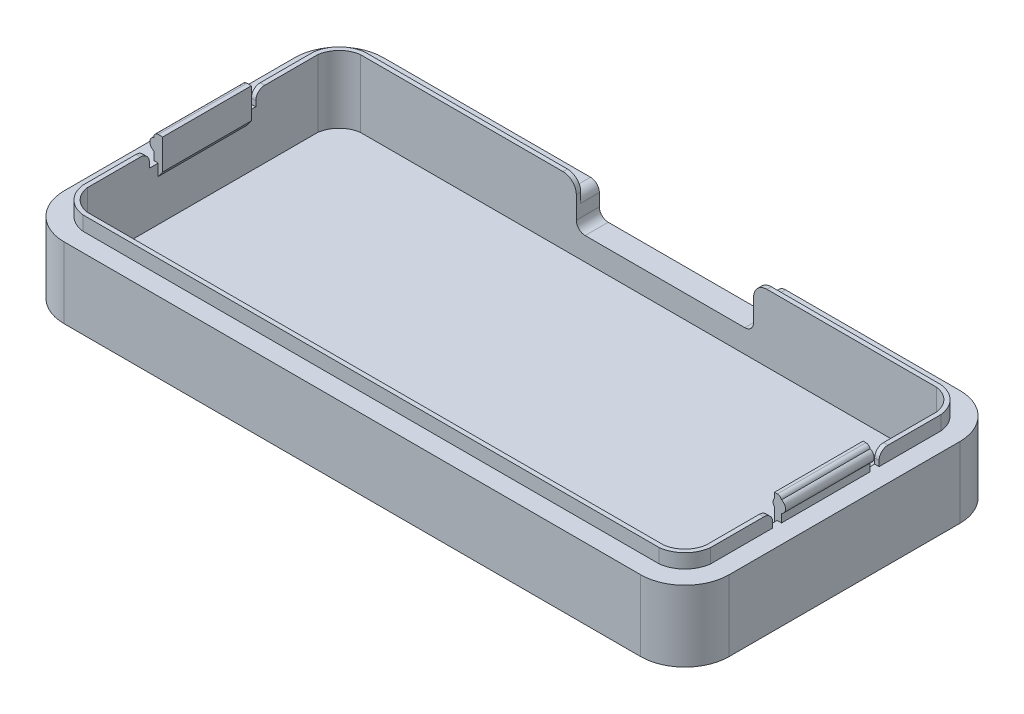
from build123d import *

# Parameters (mm, degrees)
EXTRUDE_2_DEPTH       = 8
EXTRUDE_4_DEPTH       = 1.6
SKETCH_7_W            = 0.5
SKETCH_7_H            = 10
EXTRUDE_8_DEPTH       = 2.8
SKETCH_8_R            = 0.7
EXTRUDE_9_DEPTH       = 10
FILLET_1_R            = 0.5
SKETCH_11_W           = 1
SKETCH_11_H           = 1.6
CUT_EXTRUDE_1_DEPTH   = 1.2
FILLET_2_R            = 1
SKETCH_13_W           = 0.5
SKETCH_13_H           = 10
EXTRUDE_10_DEPTH      = 2.8
CUT_EXTRUDE_START     = -6
CUT_EXTRUDE_2_DEPTH   = 6
SKETCH_13_2_W         = 0.5
SKETCH_13_2_H         = 10
EXTRUDE_11_DEPTH      = 2
EXTRUDE_12_DEPTH      = 1.6
EXTRUDE_12_DEPTH_BACK = 2
SKETCH_5_W            = 0.3
SKETCH_5_H            = 10
SKETCH_17_W           = 0.5
SKETCH_17_H           = 1
CUT_EXTRUDE_3_DEPTH   = 1.6
SKETCH_19_W           = 0.8
SKETCH_19_H           = 10
EXTRUDE_15_DEPTH      = 1
SKETCH_20_R           = 0.7
EXTRUDE_16_DEPTH      = 10
FILLET_4_R            = 0.5
CHAMFER_11_SIZE       = 1
CHAMFER_11_SIZE_2     = 1.37638192
FILLET_5_R            = 1
CHAMFER_12_SIZE       = 1
SKETCH_41_W           = 20
SKETCH_41_H           = 2.629178084
CUT_EXTRUDE_15_DEPTH  = 5
FILLET_6_R            = 1.5
FILLET_7_R            = 1
SKETCH_40_W           = 0.815007944
SKETCH_40_H           = 4.86663949
CUT_EXTRUDE_16_DEPTH  = 0.5


# Some blends are built 0.0001 mm under size
with BuildPart() as part:
    # case 2 → 凸台-拉伸2 (new body)
    with BuildSketch(Plane(origin=(0, 0, 0), x_dir=(1, 0, 0), z_dir=(0, 1, 0))):
        with BuildLine():
            Line((-34.042196447, 18), (30.957803553, 18))
            ThreePointArc((30.957803553, 18), (34.493337459, 16.535533906), (35.957803553, 13))
            Line((35.957803553, 13), (35.957803553, -13))
            ThreePointArc((35.957803553, -13), (34.493337459, -16.535533906), (30.957803553, -18))
            Line((30.957803553, -18), (-34.042196447, -18))
            ThreePointArc((-34.042196447, -18), (-37.577730353, -16.535533906), (-39.042196447, -13))
            Line((-39.042196447, -13), (-39.042196447, 13))
            ThreePointArc((-39.042196447, 13), (-37.577730353, 16.535533906), (-34.042196447, 18))
        make_face()
    extrude(amount=EXTRUDE_2_DEPTH)

    # 草图3 → 凸台-拉伸4 (add)
    with BuildSketch(Plane(origin=(0, 8, 0), x_dir=(1, 0, 0), z_dir=(0, 1, 0))):
        with BuildLine():
            Line((-36.942196447, 13), (-36.942196447, -13))
            ThreePointArc((-36.942196447, -13), (-35.997398295, -14.955201848), (-34.042196447, -15.9))
            Line((-34.042196447, -15.9), (30.957803553, -15.9))
            ThreePointArc((30.957803553, -15.9), (32.913005401, -14.955201848), (33.857803553, -13))
            Line((33.857803553, -13), (33.857803553, 13))
            ThreePointArc((33.857803553, 13), (32.913005401, 14.955201848), (30.957803553, 15.9))
            Line((30.957803553, 15.9), (-34.042196447, 15.9))
            ThreePointArc((-34.042196447, 15.9), (-35.997398295, 14.955201848), (-36.942196447, 13))
        make_face()
        with BuildLine():
            Line((-34.042196447, -15.4), (30.957803553, -15.4))
            ThreePointArc((30.957803553, -15.4), (32.562900965, -14.605097413), (33.357803553, -13))
            Line((33.357803553, -13), (33.357803553, 13))
            ThreePointArc((33.357803553, 13), (32.562900965, 14.605097413), (30.957803553, 15.4))
            Line((30.957803553, 15.4), (-34.042196447, 15.4))
            ThreePointArc((-34.042196447, 15.4), (-35.64729386, 14.605097413), (-36.442196447, 13))
            Line((-36.442196447, 13), (-36.442196447, -13))
            ThreePointArc((-36.442196447, -13), (-35.64729386, -14.605097413), (-34.042196447, -15.4))
        make_face(mode=Mode.SUBTRACT)
    extrude(amount=EXTRUDE_4_DEPTH)

    # 草图7 → 凸台-拉伸8 (add)
    with BuildSketch(Plane(origin=(0, 8, 0), x_dir=(1, 0, 0), z_dir=(0, 1, 0))):
        with Locations((-36.692196447, 0)):
            Rectangle(SKETCH_7_W, SKETCH_7_H)
    extrude(amount=EXTRUDE_8_DEPTH)

    # 草图8 → 凸台-拉伸9 (add)
    with BuildSketch(Plane.XY.offset(5)):
        with Locations((-36.692196447, 9.6)):
            Circle(SKETCH_8_R)
    extrude(amount=-EXTRUDE_9_DEPTH)

    # 圆角1
    fillet_1_edges = [part.edges().sort_by_distance(p)[0] for p in [
        (-36.942196447, 10.8, 0),
    ]]
    fillet(fillet_1_edges, radius=FILLET_1_R - 0.0001)  # a hair under: the kernel refuses the full size

    # 草图11 → 切除-拉伸1 (cut)
    with BuildSketch(Plane.ZY.offset(36.942196447)):
        with Locations((5.5, 8.8)):
            Rectangle(SKETCH_11_W, SKETCH_11_H)
        with Locations((-5.5, 8.8)):
            Rectangle(SKETCH_11_W, SKETCH_11_H)
    extrude(amount=-CUT_EXTRUDE_1_DEPTH, mode=Mode.SUBTRACT)

    # 圆角2
    fillet_2_edges = [part.edges().sort_by_distance(p)[0] for p in [
        (-36.692196447, 9.6, 6),
        (-36.692196447, 9.6, -6),
    ]]
    fillet(fillet_2_edges, radius=FILLET_2_R)

    # 草图13 → 凸台-拉伸10 (add)
    with BuildSketch(Plane(origin=(0, 8, 0), x_dir=(1, 0, 0), z_dir=(0, 1, 0))):
        with Locations((-36.192196447, 0)):
            Rectangle(SKETCH_13_W, SKETCH_13_H)
    extrude(amount=EXTRUDE_10_DEPTH)

    # 草图14 → 切除-拉伸2 (cut)
    with BuildSketch(Plane(origin=(0, 8, 0), x_dir=(1, 0, 0), z_dir=(0, 1, 0)).offset(CUT_EXTRUDE_START)):
        with BuildLine():
            Line((-34.042196447, -15.4), (30.957803553, -15.4))
            ThreePointArc((30.957803553, -15.4), (32.562900965, -14.605097413), (33.357803553, -13))
            Line((33.357803553, -13), (33.357803553, 13))
            ThreePointArc((33.357803553, 13), (32.562900965, 14.605097413), (30.957803553, 15.4))
            Line((30.957803553, 15.4), (-34.042196447, 15.4))
            ThreePointArc((-34.042196447, 15.4), (-35.64729386, 14.605097413), (-36.442196447, 13))
            Line((-36.442196447, 13), (-36.442196447, -13))
            ThreePointArc((-36.442196447, -13), (-35.64729386, -14.605097413), (-34.042196447, -15.4))
        make_face()
    extrude(amount=CUT_EXTRUDE_2_DEPTH, mode=Mode.SUBTRACT)

    # 草图13<2> → 凸台-拉伸11 (add)
    with BuildSketch(Plane(origin=(0, 8, 0), x_dir=(1, 0, 0), z_dir=(0, 1, 0))):
        with Locations((-36.192196447, 0)):
            Rectangle(SKETCH_13_2_W, SKETCH_13_2_H)
    extrude(amount=-EXTRUDE_11_DEPTH)

    # 草图5 → 凸台-拉伸12 (add, two sides: drawn at the far end of the back side and taken through both)
    with BuildSketch(Plane(origin=(0, 8, 0), x_dir=(1, 0, 0), z_dir=(0, 1, 0)).offset(-EXTRUDE_12_DEPTH_BACK)):
        with Locations((33.207803553, 0)):
            Rectangle(SKETCH_5_W, SKETCH_5_H)
    extrude(amount=EXTRUDE_12_DEPTH + EXTRUDE_12_DEPTH_BACK)

    # 草图17 → 切除-拉伸3 (cut)
    with BuildSketch(Plane(origin=(0, 9.6, 0), x_dir=(1, 0, 0), z_dir=(0, 1, 0))):
        with Locations((33.607803553, -5.5)):
            Rectangle(SKETCH_17_W, SKETCH_17_H)
        with Locations((33.607803553, 5.5)):
            Rectangle(SKETCH_17_W, SKETCH_17_H)
    extrude(amount=-CUT_EXTRUDE_3_DEPTH, mode=Mode.SUBTRACT)

    # 草图19 → 凸台-拉伸15 (add)
    with BuildSketch(Plane(origin=(0, 9.6, 0), x_dir=(1, 0, 0), z_dir=(0, 1, 0))):
        with Locations((33.457803553, 0)):
            Rectangle(SKETCH_19_W, SKETCH_19_H)
    extrude(amount=EXTRUDE_15_DEPTH)

    # 草图20 → 凸台-拉伸16 (add)
    with BuildSketch(Plane(origin=(0, 0, -5), x_dir=(-1, 0, 0), z_dir=(0, 0, -1))):
        with Locations((-33.607803553, 9.6)):
            Circle(SKETCH_20_R)
    extrude(amount=-EXTRUDE_16_DEPTH)

    # 圆角4
    # the kernel refuses this fillet: 0.5 mm, written as the material it takes off along each edge
    with BuildSketch(Plane(origin=(33.857803553, 10.6, -6.189366537), x_dir=(-1, 0, 0), z_dir=(0, 0, 1))) as fillet_4_piece_1:
        with BuildLine():
            CenterArc((0.475746615, 0.5), FILLET_4_R, 197.918850754, 72.081149246)
            Line((0, 0.346165158), (-0.009514932, 0.343088462))
            ThreePointArc((-0.009514932, 0.343088462), (-0.01, 0.173082579), (-0.01, 0))
            Line((-0.01, 0), (0, -0.01))
            Line((0, -0.01), (0.475746615, -0.01))
            Line((0.475746615, -0.01), (0.475746615, 0))
        make_face()
    extrude(amount=12.378733074, mode=Mode.SUBTRACT)

    # 倒角11
    # the kernel refuses this chamfer: 1.37638192, 1 mm, written as the material it takes off along each edge
    with BuildSketch(Plane(origin=(-35.942196447, 6, 8.553227563), x_dir=(-0.9990705747005859, -0.04310437063037643, 0), z_dir=(0, 0, -1))) as chamfer_11_piece_1_section:
        Polygon((CHAMFER_11_SIZE * 0.999070574701, CHAMFER_11_SIZE * 0.0431043706304), (-CHAMFER_11_SIZE_2 * 0.0431043706451, CHAMFER_11_SIZE_2 * 0.999070575043), (0, 0), align=None)
    chamfer_11_piece_1 = extrude(amount=17.106455125, mode=Mode.PRIVATE)
    chamfer_11_piece_1 = split(chamfer_11_piece_1, bisect_by=Plane(origin=(-36.442196447, 6.546250957, 0), z_dir=(1, 0, 0)), keep=Keep.TOP, mode=Mode.PRIVATE)
    add(chamfer_11_piece_1, mode=Mode.SUBTRACT)

    # 圆角5
    fillet_5_edges = [part.edges().sort_by_distance(p)[0] for p in [
        (33.607803553, 9.6, 6),
        (33.607803553, 9.6, -6),
    ]]
    fillet(fillet_5_edges, radius=FILLET_5_R)

    # 倒角12
    # the kernel refuses this chamfer: 1 mm, written as the material it takes off along each edge
    with BuildSketch(Plane(origin=(33.057803553, 6, 7.571682988), x_dir=(0.9996219169112968, -0.027495876610586414, 0), z_dir=(0, 0, -1))) as chamfer_12_piece_1_section:
        Polygon((CHAMFER_12_SIZE * 0.999621916911, -CHAMFER_12_SIZE * 0.0274958766106), (-CHAMFER_12_SIZE * 0.0274958766106, -CHAMFER_12_SIZE * 0.999621916911), (0, 0), align=None)
    chamfer_12_piece_1 = extrude(amount=15.143365976, mode=Mode.PRIVATE)
    chamfer_12_piece_1 = split(chamfer_12_piece_1, bisect_by=Plane(origin=(33.357803553, 6.436497273, 0), z_dir=(-1, 0, 0)), keep=Keep.TOP, mode=Mode.PRIVATE)
    add(chamfer_12_piece_1, mode=Mode.SUBTRACT)

    # 草图41 → 切除-拉伸15 (cut)
    with BuildSketch(Plane(origin=(0, 9.6, 0), x_dir=(1, 0, 0), z_dir=(0, 1, 0))):
        with Locations((0.309679061, 16.685410958)):
            Rectangle(SKETCH_41_W, SKETCH_41_H)
    extrude(amount=-CUT_EXTRUDE_15_DEPTH, mode=Mode.SUBTRACT)

    # 圆角6
    fillet_6_edges = [part.edges().sort_by_distance(p)[0] for p in [
        (10.309679061, 9.6, -15.65),
        (-9.690320939, 9.6, -15.65),
    ]]
    fillet(fillet_6_edges, radius=FILLET_6_R)

    # 圆角7
    fillet_7_edges = [part.edges().sort_by_distance(p)[0] for p in [
        (10.309679061, 8, -16.95),
        (-9.690320939, 8, -16.95),
        (10.309679061, 4.6, -16.7),
        (-9.690320939, 4.6, -16.7),
    ]]
    fillet(fillet_7_edges, radius=FILLET_7_R)

    # 草图40 → 切除-拉伸16 (cut)
    # profile 1 of 9: a face of its own
    with BuildSketch(Plane.XZ):
        with BuildLine():
            Line((-26.796380023, 4.263919287), (-26.796380023, -2.551685513))
            add(Edge.make_bspline(
                [(-26.796380023, -2.551685513), (-26.796380023, -3.167115292), (-26.465813469, -3.731311428), (-25.935877439, -4.039026317)],
                knots=[10, 10, 10, 10, 11, 11, 11, 11], degree=3))
            Line((-25.935877439, -4.039026317), (-25.115234838, -4.512024483))
            Line((-25.115234838, -4.512024483), (-20.858355687, -6.968143721))
            Line((-20.858355687, -6.968143721), (-20.037713086, -7.446811326))
            add(Edge.make_bspline(
                [(-20.037713086, -7.446811326), (-19.769892961, -7.600686162), (-19.473551731, -7.674771469), (-19.177210502, -7.674771469)],
                knots=[14, 14, 14, 14, 15, 15, 15, 15], degree=3))
            add(Edge.make_bspline(
                [(-19.177210502, -7.674771469), (-18.880869273, -7.674771469), (-18.584597607, -7.600686162), (-18.316707918, -7.446811326)],
                knots=[15, 15, 15, 15, 16, 16, 16, 16], degree=3))
            Line((-18.316707918, -7.446811326), (-17.496134881, -6.968143721))
            Line((-17.496134881, -6.968143721), (-13.239255729, -4.512024483))
            Line((-13.239255729, -4.512024483), (-12.418682692, -4.039026317))
            add(Edge.make_bspline(
                [(-12.418682692, -4.039026317), (-11.882972878, -3.731311428), (-11.558180108, -3.167115292), (-11.558180108, -2.551685513)],
                knots=[19, 19, 19, 19, 20, 20, 20, 20], degree=3))
            Line((-11.558180108, -2.551685513), (-11.558180108, 4.263919287))
            add(Edge.make_bspline(
                [(-11.558180108, 4.263919287), (-11.558180108, 4.873679626), (-11.882972878, 5.443545202), (-12.418682692, 5.751260091)],
                knots=[21, 21, 21, 21, 22, 22, 22, 22], degree=3))
            Line((-12.418682692, 5.751260091), (-13.239255729, 6.224258257))
            Line((-13.239255729, 6.224258257), (-17.496134881, 8.680377495))
            Line((-17.496134881, 8.680377495), (-18.316707918, 9.159079882))
            add(Edge.make_bspline(
                [(-18.316707918, 9.159079882), (-18.584597607, 9.307215715), (-18.880869273, 9.387005243), (-19.177210502, 9.387005243)],
                knots=[3, 3, 3, 3, 4, 4, 4, 4], degree=3))
            add(Edge.make_bspline(
                [(-19.177210502, 9.387005243), (-19.473551731, 9.387005243), (-19.769892961, 9.307215715), (-20.037713086, 9.159079882)],
                knots=[4, 4, 4, 4, 5, 5, 5, 5], degree=3))
            Line((-20.037713086, 9.159079882), (-20.858355687, 8.680377495))
            Line((-20.858355687, 8.680377495), (-25.115234838, 6.224258257))
            Line((-25.115234838, 6.224258257), (-25.935877439, 5.751260091))
            add(Edge.make_bspline(
                [(-25.935877439, 5.751260091), (-26.465813469, 5.443545202), (-26.796380023, 4.873679626), (-26.796380023, 4.263919287)],
                knots=[8, 8, 8, 8, 9, 9, 9, 9], degree=3))
        make_face()
        with BuildLine():
            Line((-24.841710492, 5.073118665), (-19.576158143, 8.11621614))
            add(Edge.make_bspline(
                [(-19.576158143, 8.11621614), (-19.331085337, 8.258682534), (-19.023335666, 8.258682534), (-18.772628204, 8.11621614)],
                knots=[3, 3, 3, 3, 4, 4, 4, 4], degree=3))
            Line((-18.772628204, 8.11621614), (-13.535596959, 5.067414444))
            add(Edge.make_bspline(
                [(-13.535596959, 5.067414444), (-13.267776834, 4.913574391), (-13.262072613, 4.526069973), (-13.529892738, 4.366490917)],
                knots=[5, 5, 5, 5, 6, 6, 6, 6], degree=3))
            Line((-13.529892738, 4.366490917), (-18.618753368, 1.323428223))
            add(Edge.make_bspline(
                [(-18.618753368, 1.323428223), (-18.960728365, 1.123954403), (-19.388127546, 1.123954403), (-19.730032978, 1.323428223)],
                knots=[7, 7, 7, 7, 8, 8, 8, 8], degree=3))
            add(Edge.make_bspline(
                [(-19.730032978, 1.323428223), (-24.881570474, 4.29810983), (-24.892978916, 4.303814051)],
                knots=[0, 0, 0, 1, 1, 1], degree=2))
            add(Edge.make_bspline(
                [(-24.892978916, 4.303814051), (-25.160799041, 4.497548869), (-25.132347501, 4.90787017), (-24.841710492, 5.073118665)],
                knots=[1, 1, 1, 1, 2, 2, 2, 2], degree=3))
        make_face(mode=Mode.SUBTRACT)
        with BuildLine():
            Line((-17.040214595, -3.833883057), (-17.632897054, -4.164380048))
            Line((-17.632897054, -4.164380048), (-17.632897054, -3.081656324))
            Line((-17.632897054, -3.081656324), (-17.108665245, -2.819505638))
            add(Edge.make_bspline(
                [(-16.151260471, -1.434736464), (-16.151260471, -1.976115717), (-16.458940578, -2.454783323), (-17.108665245, -2.819505638)],
                knots=[0, 0, 0, 0, 1, 1, 1, 1], degree=3))
            add(Edge.make_bspline(
                [(-17.142821007, -1.246671086), (-16.504574345, -0.881983552), (-16.151260471, -0.876279331), (-16.151260471, -1.434736464)],
                knots=[6, 6, 6, 6, 7, 7, 7, 7], degree=3))
            Line((-17.142821007, -1.246671086), (-17.632897054, -1.520230213))
            add(Edge.make_bspline(
                [(-17.689939262, -1.617097622), (-17.689939262, -1.577202858), (-17.667122379, -1.537308094), (-17.632897054, -1.520230213)],
                knots=[4, 4, 4, 4, 5, 5, 5, 5], degree=3))
            Line((-17.689939262, -1.617097622), (-17.689939262, -2.961972032))
            Line((-17.689939262, -2.961972032), (-17.689939262, -4.261282239))
            Line((-17.689939262, -4.261282239), (-17.689939262, -5.970878964))
            add(Edge.make_bspline(
                [(-17.689939262, -5.970878964), (-17.689939262, -6.010773728), (-17.706982361, -6.044964272), (-17.746842343, -6.067746373)],
                knots=[3, 3, 3, 3, 4, 4, 4, 4], degree=3))
            Line((-17.746842343, -6.067746373), (-18.852417732, -6.694584593))
            add(Edge.make_bspline(
                [(-18.852417732, -6.694584593), (-18.926503039, -6.734479357), (-19.017701009, -6.683210933), (-19.017701009, -6.597717184)],
                knots=[5, 5, 5, 5, 6, 6, 6, 6], degree=3))
            Line((-19.017701009, -6.597717184), (-19.017701009, -1.320756393))
            add(Edge.make_bspline(
                [(-19.017701009, -1.320756393), (-19.017701009, -1.280861629), (-19.000588347, -1.240966865), (-18.960728365, -1.223888984)],
                knots=[7, 7, 7, 7, 8, 8, 8, 8], degree=3))
            Line((-18.960728365, -1.223888984), (-17.080144141, -0.158243141))
            add(Edge.make_bspline(
                [(-17.080144141, -0.158243141), (-15.860623463, 0.531306726), (-14.852019828, 0.668068899), (-14.852019828, -0.699622394)],
                knots=[9, 9, 9, 9, 10, 10, 10, 10], degree=3))
            add(Edge.make_bspline(
                [(-14.852019828, -0.699622394), (-14.852019828, -2.016010481), (-15.872031904, -3.172819512), (-17.040214595, -3.833883057)],
                knots=[10, 10, 10, 10, 11, 11, 11, 11], degree=3))
        make_face(mode=Mode.SUBTRACT)
        with BuildLine():
            Line((-13.136718882, -3.480569183), (-14.230816265, -4.101703182))
            add(Edge.make_bspline(
                [(-14.230816265, -4.101703182), (-14.304901573, -4.141597947), (-14.396099542, -4.090294741), (-14.396099542, -4.004835774)],
                knots=[2, 2, 2, 2, 3, 3, 3, 3], degree=3))
            Line((-14.396099542, -4.004835774), (-14.396099542, -1.491709109))
            add(Edge.make_bspline(
                [(-14.396099542, -1.491709109), (-14.396099542, -1.451849127), (-14.373282659, -1.417623802), (-14.339057334, -1.3948417)],
                knots=[4, 4, 4, 4, 5, 5, 5, 5], degree=3))
            Line((-14.339057334, -1.3948417), (-13.24495995, -0.77937714))
            add(Edge.make_bspline(
                [(-13.24495995, -0.77937714), (-13.170874643, -0.739517158), (-13.079676673, -0.790785582), (-13.079676673, -0.876279331)],
                knots=[6, 6, 6, 6, 7, 7, 7, 7], degree=3))
            Line((-13.079676673, -0.876279331), (-13.079676673, -3.383666993))
            add(Edge.make_bspline(
                [(-13.079676673, -3.383666993), (-13.079676673, -3.423561757), (-13.102493557, -3.463456521), (-13.136718882, -3.480569183)],
                knots=[0, 0, 0, 0, 1, 1, 1, 1], degree=3))
        make_face(mode=Mode.SUBTRACT)
        with BuildLine():
            add(Edge.make_bspline(
                [(-13.735035997, 0.890324821), (-13.296228374, 1.141067065), (-12.982844046, 1.032791215), (-12.982844046, 0.633878356), (-12.982844046, 0.240669718), (-13.296228374, -0.220920007), (-13.735035997, -0.46595803)],
                knots=[2, 2, 2, 2, 3, 3, 3, 4, 4, 4, 4], degree=3))
            add(Edge.make_bspline(
                [(-13.735035997, -0.46595803), (-14.179478278, -0.722404496), (-14.492932169, -0.614128645), (-14.492932169, -0.220920007), (-14.492932169, 0.183697073), (-14.179478278, 0.639582577), (-13.735035997, 0.890324821)],
                knots=[0, 0, 0, 0, 1, 1, 1, 2, 2, 2, 2], degree=3))
        make_face(mode=Mode.SUBTRACT)
    # profile 2 of 9: a face of its own
    with BuildSketch(Plane.XZ):
        with BuildLine():
            Line((-7.563416861, 3.7852169), (-9.438296864, 3.7852169))
            Line((-9.438296864, 3.7852169), (-9.438296864, -2.779610874))
            Line((-9.438296864, -2.779610874), (-8.606245821, -2.779610874))
            Line((-8.606245821, -2.779610874), (-8.606245821, -0.175321022))
            Line((-8.606245821, -0.175321022), (-7.517783094, -0.175321022))
            add(Edge.make_bspline(
                [(-7.517783094, -0.175321022), (-6.087414936, -0.175321022), (-5.101558621, 0.4742993), (-5.101558621, 1.859103255)],
                knots=[5, 5, 5, 5, 6, 6, 6, 6], degree=3))
            add(Edge.make_bspline(
                [(-5.101558621, 1.859103255), (-5.101558621, 3.295140853), (-6.087414936, 3.7852169), (-7.563416861, 3.7852169)],
                knots=[6, 6, 6, 6, 7, 7, 7, 7], degree=3))
        make_face()
        with BuildLine():
            Line((-7.626024163, 0.497116183), (-8.606245821, 0.497116183))
            Line((-8.606245821, 0.497116183), (-8.606245821, 3.112779695))
            Line((-8.606245821, 3.112779695), (-7.660249488, 3.112779695))
            add(Edge.make_bspline(
                [(-7.660249488, 3.112779695), (-6.509109896, 3.112779695), (-5.927835879, 2.810769027), (-5.927835879, 1.859103255)],
                knots=[3, 3, 3, 3, 4, 4, 4, 4], degree=3))
            add(Edge.make_bspline(
                [(-5.927835879, 1.859103255), (-5.927835879, 0.918811144), (-6.469249914, 0.497116183), (-7.626024163, 0.497116183)],
                knots=[4, 4, 4, 4, 5, 5, 5, 5], degree=3))
        make_face(mode=Mode.SUBTRACT)
    # profile 3 of 9: a face of its own
    with BuildSketch(Plane.XZ):
        with Locations((-3.617069928, -0.346291129)):
            Rectangle(SKETCH_40_W, SKETCH_40_H)
    # profile 4 of 9: a face of its own
    with BuildSketch(Plane.XZ):
        with BuildLine():
            Line((1.497459697, 1.009974332), (0.665478217, 1.340506104))
            add(Edge.make_bspline(
                [(0.665478217, 1.340506104), (0.07849998, 1.574170468), (-0.343194981, 1.716636861), (-0.343194981, 2.087028616)],
                knots=[1, 1, 1, 1, 2, 2, 2, 2], degree=3))
            add(Edge.make_bspline(
                [(-0.343194981, 2.087028616), (-0.343194981, 2.44034249), (-0.041149531, 2.639816311), (0.454630737, 2.639816311)],
                knots=[2, 2, 2, 2, 3, 3, 3, 3], degree=3))
            add(Edge.make_bspline(
                [(0.454630737, 2.639816311), (0.973158325, 2.639816311), (1.383514407, 2.463159374), (1.822252467, 2.12692338)],
                knots=[3, 3, 3, 3, 4, 4, 4, 4], degree=3))
            Line((1.822252467, 2.12692338), (2.620147748, 3.129892358))
            add(Edge.make_bspline(
                [(2.620147748, 3.129892358), (2.038873731, 3.716835814), (1.223935351, 4.013177043), (0.454630737, 4.013177043)],
                knots=[5, 5, 5, 5, 6, 6, 6, 6], degree=3))
            add(Edge.make_bspline(
                [(0.454630737, 4.013177043), (-0.96432898, 4.013177043), (-1.967297957, 3.112779695), (-1.967297957, 1.995865428)],
                knots=[6, 6, 6, 6, 7, 7, 7, 7], degree=3))
            add(Edge.make_bspline(
                [(-1.967297957, 1.995865428), (-1.967297957, 1.027086994), (-1.312008197, 0.445812977), (-0.611015106, 0.16658441)],
                knots=[7, 7, 7, 7, 8, 8, 8, 8], degree=3))
            Line((-0.611015106, 0.16658441), (0.238079036, -0.192433684))
            add(Edge.make_bspline(
                [(0.238079036, -0.192433684), (0.807944611, -0.431767487), (1.178371148, -0.557156), (1.178371148, -0.944660417)],
                knots=[9, 9, 9, 9, 10, 10, 10, 10], degree=3))
            add(Edge.make_bspline(
                [(1.178371148, -0.944660417), (1.178371148, -1.303678512), (0.899142581, -1.525899652), (0.306460122, -1.525899652)],
                knots=[10, 10, 10, 10, 11, 11, 11, 11], degree=3))
            add(Edge.make_bspline(
                [(0.306460122, -1.525899652), (-0.217771686, -1.525899652), (-0.838975249, -1.246671086), (-1.312008197, -0.842088788)],
                knots=[11, 11, 11, 11, 12, 12, 12, 12], degree=3))
            Line((-1.312008197, -0.842088788), (-2.21800542, -1.947629395))
            add(Edge.make_bspline(
                [(-2.21800542, -1.947629395), (-1.528490334, -2.580171836), (-0.593972007, -2.904999387), (0.272234797, -2.904999387)],
                knots=[13, 13, 13, 13, 14, 14, 14, 14], degree=3))
            add(Edge.make_bspline(
                [(0.272234797, -2.904999387), (1.884998896, -2.904999387), (2.819517223, -1.930516732), (2.819517223, -0.819271904)],
                knots=[14, 14, 14, 14, 15, 15, 15, 15], degree=3))
            add(Edge.make_bspline(
                [(2.819517223, -0.819271904), (2.819517223, 0.120985426), (2.323806519, 0.679477341), (1.497459697, 1.009974332)],
                knots=[15, 15, 15, 15, 16, 16, 16, 16], degree=3))
        make_face()
    # profile 5 of 9: a face of its own
    with BuildSketch(Plane.XZ):
        with BuildLine():
            Line((6.603502553, 2.314988759), (6.603502553, -1.024449946))
            add(Edge.make_bspline(
                [(6.603502553, -1.024449946), (6.335682428, -1.400545921), (6.113356943, -1.543012315), (5.754408412, -1.543012315)],
                knots=[1, 1, 1, 1, 2, 2, 2, 2], degree=3))
            add(Edge.make_bspline(
                [(5.754408412, -1.543012315), (5.34975655, -1.543012315), (5.161725953, -1.343573276), (5.161725953, -0.636910746)],
                knots=[2, 2, 2, 2, 3, 3, 3, 3], degree=3))
            Line((5.161725953, -0.636910746), (5.161725953, 2.314988759))
            Line((5.161725953, 2.314988759), (3.571778738, 2.314988759))
            Line((3.571778738, 2.314988759), (3.571778738, -0.836384567))
            add(Edge.make_bspline(
                [(3.571778738, -0.836384567), (3.571778738, -2.107173669), (4.044811686, -2.904999387), (5.156021732, -2.904999387)],
                knots=[6, 6, 6, 6, 7, 7, 7, 7], degree=3))
            add(Edge.make_bspline(
                [(5.156021732, -2.904999387), (5.851241039, -2.904999387), (6.329978208, -2.580171836), (6.751673168, -2.078687347)],
                knots=[7, 7, 7, 7, 8, 8, 8, 8], degree=3))
            Line((6.751673168, -2.078687347), (6.785828929, -2.078687347))
            Line((6.785828929, -2.078687347), (6.899843783, -2.779610874))
            Line((6.899843783, -2.779610874), (8.199084426, -2.779610874))
            Line((8.199084426, -2.779610874), (8.199084426, 2.314988759))
            Line((8.199084426, 2.314988759), (6.603502553, 2.314988759))
        make_face()
    # profile 6 of 9: a face of its own
    with BuildSketch(Plane.XZ):
        with BuildLine():
            Line((12.051381279, -1.776641897), (11.24785134, -1.776641897))
            add(Edge.make_bspline(
                [(11.24785134, -1.776641897), (10.700802648, -1.776641897), (10.495659389, -1.668366046), (10.495659389, -1.434736464)],
                knots=[1, 1, 1, 1, 2, 2, 2, 2], degree=3))
            add(Edge.make_bspline(
                [(10.495659389, -1.434736464), (10.495659389, -1.263783748), (10.535519371, -1.18399422), (10.655168882, -1.07571837)],
                knots=[2, 2, 2, 2, 3, 3, 3, 3], degree=3))
            add(Edge.make_bspline(
                [(10.655168882, -1.07571837), (10.877494367, -1.138395235), (11.082568063, -1.166916339), (11.253555561, -1.166916339)],
                knots=[3, 3, 3, 3, 4, 4, 4, 4], degree=3))
            add(Edge.make_bspline(
                [(11.253555561, -1.166916339), (12.38187827, -1.166916339), (13.28801462, -0.648319188), (13.28801462, 0.542680386)],
                knots=[4, 4, 4, 4, 5, 5, 5, 5], degree=3))
            add(Edge.make_bspline(
                [(13.28801462, 0.542680386), (13.28801462, 0.787753191), (13.225268191, 1.021382773), (13.145548226, 1.163849167)],
                knots=[5, 5, 5, 5, 6, 6, 6, 6], degree=3))
            Line((13.145548226, 1.163849167), (13.931895939, 1.163849167))
            Line((13.931895939, 1.163849167), (13.931895939, 2.314988759))
            Line((13.931895939, 2.314988759), (12.062789721, 2.314988759))
            add(Edge.make_bspline(
                [(12.062789721, 2.314988759), (11.829125357, 2.400447726), (11.54989679, 2.44034249), (11.253555561, 2.44034249)],
                knots=[9, 9, 9, 9, 10, 10, 10, 10], degree=3))
            add(Edge.make_bspline(
                [(11.253555561, 2.44034249), (10.153753957, 2.44034249), (9.122263875, 1.836286372), (9.122263875, 0.588279371)],
                knots=[10, 10, 10, 10, 11, 11, 11, 11], degree=3))
            add(Edge.make_bspline(
                [(9.122263875, 0.588279371), (9.122263875, -0.004368306), (9.452830429, -0.477366472), (9.811778961, -0.728108716)],
                knots=[11, 11, 11, 11, 12, 12, 12, 12], degree=3))
            Line((9.811778961, -0.728108716), (9.811778961, -0.76229926))
            add(Edge.make_bspline(
                [(9.811778961, -0.76229926), (9.48128197, -0.995928841), (9.247617606, -1.354946936), (9.247617606, -1.713965031)],
                knots=[13, 13, 13, 13, 14, 14, 14, 14], degree=3))
            add(Edge.make_bspline(
                [(9.247617606, -1.713965031), (9.247617606, -2.141364213), (9.447126208, -2.409219119), (9.714946333, -2.591580277)],
                knots=[14, 14, 14, 14, 15, 15, 15, 15], degree=3))
            Line((9.714946333, -2.591580277), (9.714946333, -2.63714448))
            add(Edge.make_bspline(
                [(9.714946333, -2.63714448), (9.241913385, -2.876513065), (8.991205923, -3.218418497), (8.991205923, -3.640113458)],
                knots=[16, 16, 16, 16, 17, 17, 17, 17], degree=3))
            add(Edge.make_bspline(
                [(8.991205923, -3.640113458), (8.991205923, -4.551884465), (9.954245354, -4.922311002), (11.12820183, -4.922311002)],
                knots=[17, 17, 17, 17, 18, 18, 18, 18], degree=3))
            add(Edge.make_bspline(
                [(11.12820183, -4.922311002), (12.900475421, -4.922311002), (14.011755031, -4.158710609), (14.011755031, -3.081656324)],
                knots=[18, 18, 18, 18, 19, 19, 19, 19], degree=3))
            add(Edge.make_bspline(
                [(14.011755031, -3.081656324), (14.011755031, -2.158476875), (13.305127283, -1.776641897), (12.051381279, -1.776641897)],
                knots=[19, 19, 19, 19, 20, 20, 20, 20], degree=3))
        make_face()
        with BuildLine():
            Line((11.264964003, -2.996162575), (11.749405392, -2.996162575))
            add(Edge.make_bspline(
                [(11.749405392, -2.996162575), (12.222299213, -2.996162575), (12.490188902, -3.058839441), (12.490188902, -3.360884891)],
                knots=[4, 4, 4, 4, 5, 5, 5, 5], degree=3))
            add(Edge.make_bspline(
                [(12.490188902, -3.360884891), (12.490188902, -3.685712443), (12.03433818, -3.925046245), (11.378909292, -3.925046245)],
                knots=[5, 5, 5, 5, 6, 6, 6, 6], degree=3))
            add(Edge.make_bspline(
                [(11.378909292, -3.925046245), (10.723619532, -3.925046245), (10.29622035, -3.748389308), (10.29622035, -3.389371213)],
                knots=[0, 0, 0, 0, 1, 1, 1, 1], degree=3))
            add(Edge.make_bspline(
                [(10.29622035, -3.389371213), (10.29622035, -3.218418497), (10.375940315, -3.075952103), (10.535519371, -2.93348571)],
                knots=[1, 1, 1, 1, 2, 2, 2, 2], degree=3))
            add(Edge.make_bspline(
                [(10.535519371, -2.93348571), (10.700802648, -2.979084695), (10.89460703, -2.996162575), (11.264964003, -2.996162575)],
                knots=[2, 2, 2, 2, 3, 3, 3, 3], degree=3))
        make_face(mode=Mode.SUBTRACT)
        with BuildLine():
            add(Edge.make_bspline(
                [(11.253555561, -0.209511565), (10.888902809, -0.209511565), (10.609674242, 0.05830856), (10.609674242, 0.588279371), (10.609674242, 1.106876522), (10.888902809, 1.374696647), (11.253555561, 1.374696647)],
                knots=[2, 2, 2, 2, 3, 3, 3, 4, 4, 4, 4], degree=3))
            add(Edge.make_bspline(
                [(11.253555561, 1.374696647), (11.629686318, 1.374696647), (11.897506443, 1.106876522), (11.897506443, 0.588279371), (11.897506443, 0.05830856), (11.629686318, -0.209511565), (11.253555561, -0.209511565)],
                knots=[0, 0, 0, 0, 1, 1, 1, 2, 2, 2, 2], degree=3))
        make_face(mode=Mode.SUBTRACT)
    # profile 7 of 9: a face of its own
    with BuildSketch(Plane.XZ):
        with BuildLine():
            Line((14.387816224, 1.773609506), (14.946273358, 0.725041544))
            add(Edge.make_bspline(
                [(14.946273358, 0.725041544), (15.453531631, 1.009974332), (15.875226592, 1.169553388), (16.27980889, 1.169553388)],
                knots=[2, 2, 2, 2, 3, 3, 3, 3], degree=3))
            add(Edge.make_bspline(
                [(16.27980889, 1.169553388), (16.798336477, 1.169553388), (17.014957742, 0.930219585), (17.049113503, 0.519898285)],
                knots=[3, 3, 3, 3, 4, 4, 4, 4], degree=3))
            add(Edge.make_bspline(
                [(17.049113503, 0.519898285), (15.060288211, 0.303346583), (14.216828726, -0.277892652), (14.216828726, -1.354946936)],
                knots=[4, 4, 4, 4, 5, 5, 5, 5], degree=3))
            add(Edge.make_bspline(
                [(14.216828726, -1.354946936), (14.216828726, -2.204041078), (14.792398522, -2.904999387), (15.732760198, -2.904999387)],
                knots=[5, 5, 5, 5, 6, 6, 6, 6], degree=3))
            add(Edge.make_bspline(
                [(15.732760198, -2.904999387), (16.296921552, -2.904999387), (16.769884937, -2.642848701), (17.191579897, -2.266752726)],
                knots=[6, 6, 6, 6, 7, 7, 7, 7], degree=3))
            Line((17.191579897, -2.266752726), (17.231439879, -2.266752726))
            Line((17.231439879, -2.266752726), (17.345385169, -2.779610874))
            Line((17.345385169, -2.779610874), (18.644695376, -2.779610874))
            Line((18.644695376, -2.779610874), (18.644695376, 0.115281205))
            add(Edge.make_bspline(
                [(18.644695376, 0.115281205), (18.644695376, 1.710932641), (17.898207645, 2.44034249), (16.58185434, 2.44034249)],
                knots=[11, 11, 11, 11, 12, 12, 12, 12], degree=3))
            add(Edge.make_bspline(
                [(16.58185434, 2.44034249), (15.789663279, 2.44034249), (15.060288211, 2.172522365), (14.387816224, 1.773609506)],
                knots=[0, 0, 0, 0, 1, 1, 1, 1], degree=3))
        make_face()
        with BuildLine():
            Line((17.049113503, -0.44888015), (17.049113503, -1.263783748))
            add(Edge.make_bspline(
                [(17.049113503, -1.263783748), (16.81544914, -1.514525993), (16.604601659, -1.668366046), (16.27980889, -1.668366046)],
                knots=[0, 0, 0, 0, 1, 1, 1, 1], degree=3))
            add(Edge.make_bspline(
                [(16.27980889, -1.668366046), (15.949242335, -1.668366046), (15.732760198, -1.525899652), (15.732760198, -1.229593205)],
                knots=[1, 1, 1, 1, 2, 2, 2, 2], degree=3))
            add(Edge.make_bspline(
                [(15.732760198, -1.229593205), (15.732760198, -0.87057511), (16.057552968, -0.585642323), (17.049113503, -0.44888015)],
                knots=[2, 2, 2, 2, 3, 3, 3, 3], degree=3))
        make_face(mode=Mode.SUBTRACT)
    # profile 8 of 9: a face of its own
    with BuildSketch(Plane.XZ):
        with BuildLine():
            Line((21.13507472, 1.431704074), (21.100849395, 1.431704074))
            Line((21.100849395, 1.431704074), (20.992608326, 2.314988759))
            Line((20.992608326, 2.314988759), (19.69329812, 2.314988759))
            Line((19.69329812, 2.314988759), (19.69329812, -2.779610874))
            Line((19.69329812, -2.779610874), (21.277541114, -2.779610874))
            Line((21.277541114, -2.779610874), (21.277541114, 0.132393867))
            add(Edge.make_bspline(
                [(21.277541114, 0.132393867), (21.545361239, 0.804831072), (22.001281525, 1.044164875), (22.377342718, 1.044164875)],
                knots=[7, 7, 7, 7, 8, 8, 8, 8], degree=3))
            add(Edge.make_bspline(
                [(22.377342718, 1.044164875), (22.605302861, 1.044164875), (22.753473476, 1.009974332), (22.935799852, 0.964410128)],
                knots=[8, 8, 8, 8, 9, 9, 9, 9], degree=3))
            Line((22.935799852, 0.964410128), (23.203619977, 2.337770861))
            add(Edge.make_bspline(
                [(23.203619977, 2.337770861), (23.061153583, 2.400447726), (22.890235649, 2.44034249), (22.588190199, 2.44034249)],
                knots=[10, 10, 10, 10, 11, 11, 11, 11], degree=3))
            add(Edge.make_bspline(
                [(22.588190199, 2.44034249), (22.075297268, 2.44034249), (21.511135914, 2.109810718), (21.13507472, 1.431704074)],
                knots=[0, 0, 0, 0, 1, 1, 1, 1], degree=3))
        make_face()
    # profile 9 of 9: a face of its own
    with BuildSketch(Plane.XZ):
        with BuildLine():
            add(Edge.make_bspline(
                [(-3.614217817, 3.089997594), (-3.289425047, 3.089997594), (-3.050056463, 3.312253516), (-3.050056463, 3.614264184), (-3.050056463, 3.950500177), (-3.289425047, 4.144234995), (-3.614217817, 4.144234995)],
                knots=[2, 2, 2, 2, 3, 3, 3, 4, 4, 4, 4], degree=3))
            add(Edge.make_bspline(
                [(-3.614217817, 4.144234995), (-3.939010587, 4.144234995), (-4.178379172, 3.950500177), (-4.178379172, 3.614264184), (-4.178379172, 3.312253516), (-3.939010587, 3.089997594), (-3.614217817, 3.089997594)],
                knots=[0, 0, 0, 0, 1, 1, 1, 2, 2, 2, 2], degree=3))
        make_face()
    extrude(amount=-CUT_EXTRUDE_16_DEPTH, mode=Mode.SUBTRACT)


solid = part.part
